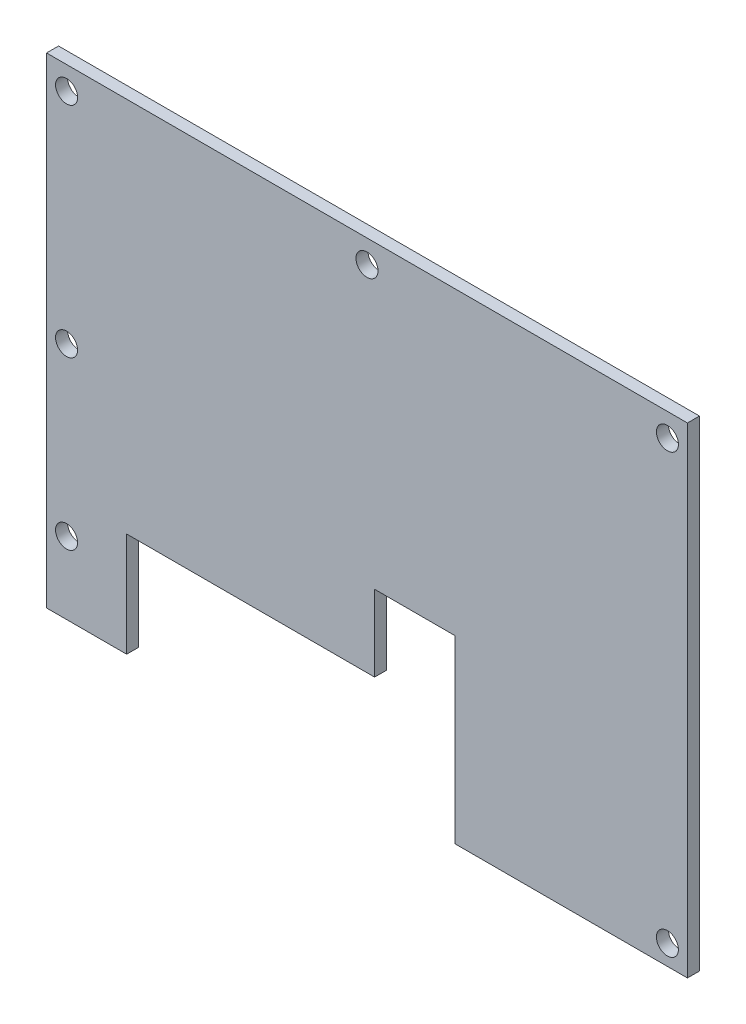
from build123d import *

# Parameters (mm, degrees)
SKETCH1_W            = 160
SKETCH1_H            = 120
BOSS_EXTRUDE1_DEPTH  = 3
CUT_EXTRUDE1_DEPTH   = 10
M5_CLEARANCE_HOLE1_D = 5.5


with BuildPart() as part:
    # Sketch1 → Boss-Extrude1 (new body)
    with BuildSketch(Plane.XY):
        with Locations((80, 60)):
            Rectangle(SKETCH1_W, SKETCH1_H)
    extrude(amount=BOSS_EXTRUDE1_DEPTH)

    # Sketch2 → Cut-Extrude1 (cut)
    with BuildSketch(Plane.XY.offset(3)):
        Polygon((81.9, 45), (81.9, 26), (20, 26), (20, 0), (102, 0), (102, 45), align=None)
    extrude(amount=-CUT_EXTRUDE1_DEPTH, mode=Mode.SUBTRACT)

    # M5 Clearance Hole1 (through all)
    with Locations(Plane.XY.offset(3)):
        with Locations((5, 114.23), (155, 5), (155, 114.23), (80, 114.23), (5, 59.615), (5, 18)):
            Hole(M5_CLEARANCE_HOLE1_D / 2)


solid = part.part
